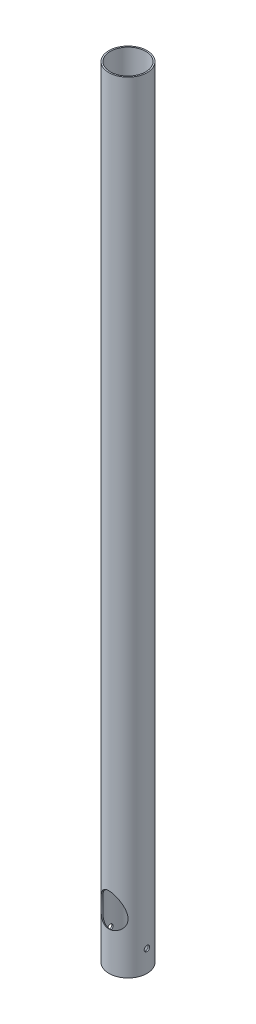
from build123d import *

# Parameters (mm, degrees)
EXTRUDE_1_OUTLINE_R      = 70.5
EXTRUDE_1_OUTLINE_R_2    = 65.5
EXTRUDE_1_DEPTH          = 2880
CUT_EXTRUDE_3_DEPTH      = 2882.72526449
CUT_EXTRUDE_3_DEPTH_BACK = 2882.72526449
SKETCH_6_R               = 10
SKETCH_7_R               = 50
CUT_EXTRUDE_4_DEPTH      = 200
SKETCH_13_R              = 52.5
CUT_EXTRUDE_8_DEPTH      = 200


# Read off the part's stored shape, not the designer's step: Вытянуть-Тонкостенный1
with BuildPart() as part:
    # Вытянуть-Тонкостенный1 outline → Вытянуть-Тонкостенный1 (new body)
    with BuildSketch(Plane(origin=(0, 0, 0), x_dir=(1, 0, 0), z_dir=(0, 1, 0))):
        Circle(EXTRUDE_1_OUTLINE_R)
        Circle(EXTRUDE_1_OUTLINE_R_2, mode=Mode.SUBTRACT)
    extrude(amount=EXTRUDE_1_DEPTH)

    # Эскиз6 → Вырез-Вытянуть3 (cut, two sides: drawn at the far end of the back side and taken through both)
    with BuildSketch(Plane(origin=(0, 0, 0), x_dir=(0, 0, -1), z_dir=(1, 0, 0)).offset(-CUT_EXTRUDE_3_DEPTH_BACK)):
        with Locations((0, 80)):
            Circle(SKETCH_6_R)
    extrude(amount=CUT_EXTRUDE_3_DEPTH + CUT_EXTRUDE_3_DEPTH_BACK, mode=Mode.SUBTRACT)

    # Эскиз7 → Вырез-Вытянуть4 (cut)
    with BuildSketch(Plane(origin=(0, 176.689515805, 252.338779809), x_dir=(1, 0, 0), z_dir=(0, -0.5735764363510416, -0.8191520442889949))):
        with Locations(Location((0, -126.118813858, 0), (0, 0, 90))):
            Circle(SKETCH_7_R)
    extrude(amount=CUT_EXTRUDE_4_DEPTH, mode=Mode.SUBTRACT)

    # Эскиз13 → Вырез-Вытянуть8 (cut)
    with BuildSketch(Plane(origin=(0, 750.265952156, 1071.490824098), x_dir=(1, 0, 0), z_dir=(0, -0.5735764363510416, -0.8191520442889949))):
        with Locations(Location((0, -2185, 0), (0, 0, 270))):
            Circle(SKETCH_13_R)
    extrude(amount=-CUT_EXTRUDE_8_DEPTH, mode=Mode.SUBTRACT)


solid = part.part
